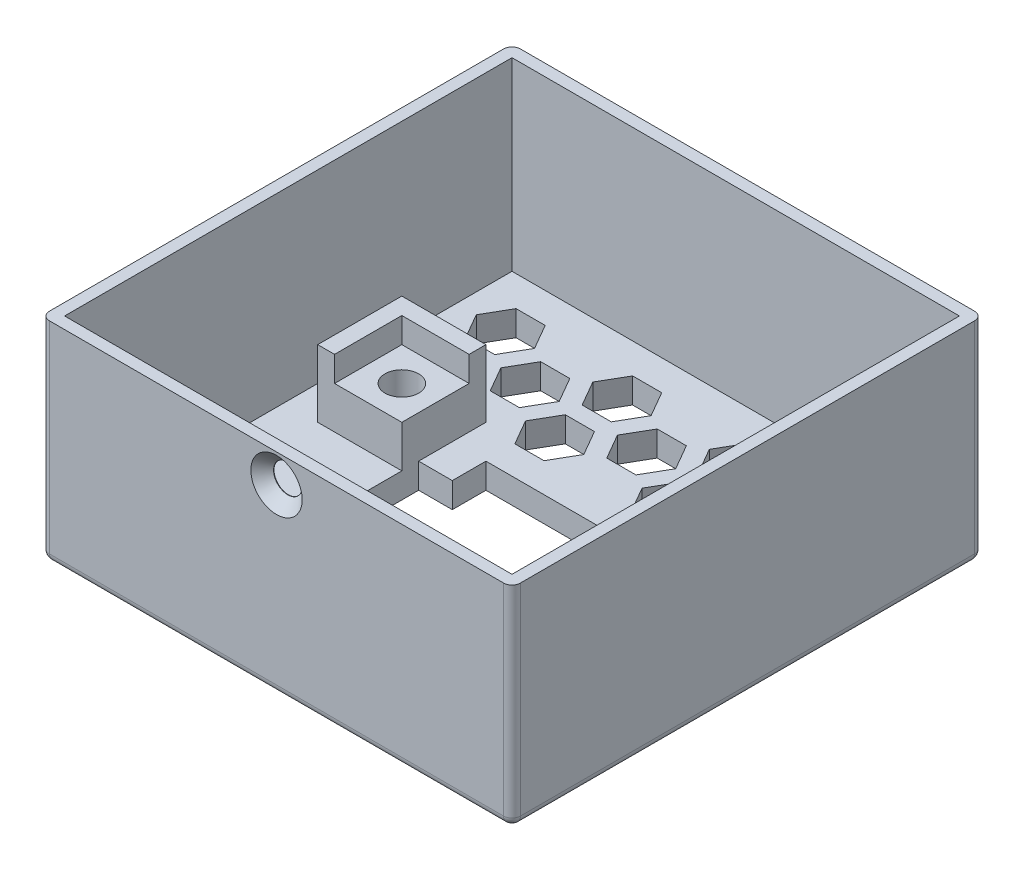
from build123d import *

# Parameters (mm, degrees)
SKETCH1_W           = 56
SKETCH1_H           = 56
BOSS_EXTRUDE1_DEPTH = 25
SKETCH2_W           = 53.2
SKETCH2_H           = 53.2
CUT_EXTRUDE1_DEPTH  = 22
SKETCH3_R           = 1.7
CUT_EXTRUDE2_DEPTH  = 1.4
SKETCH4_W           = 25.2
SKETCH4_H           = 27.2
CUT_EXTRUDE3_DEPTH  = 3
SKETCH5_W           = 4
SKETCH5_H           = 4
BOSS_EXTRUDE2_DEPTH = 3
SKETCH6_W           = 8
SKETCH6_H           = 8
BOSS_EXTRUDE3_DEPTH = 5
SKETCH7_R           = 2
CUT_EXTRUDE4_DEPTH  = 8
BOSS_EXTRUDE4_DEPTH = 3
FILLET1_R           = 1
CHAMFER1_SIZE       = 1.35
FILL_PATTERN1_DEPTH = 3


# Read off the part's stored shape, not the designer's step: Fill Pattern1
with BuildPart() as part:
    # Sketch1 → Boss-Extrude1 (new body)
    with BuildSketch(Plane(origin=(0, 0, 0), x_dir=(1, 0, 0), z_dir=(0, 1, 0))):
        Rectangle(SKETCH1_W, SKETCH1_H)
    extrude(amount=BOSS_EXTRUDE1_DEPTH)

    # Sketch2 → Cut-Extrude1 (cut)
    with BuildSketch(Plane(origin=(0, 25, 0), x_dir=(1, 0, 0), z_dir=(0, 1, 0))):
        Rectangle(SKETCH2_W, SKETCH2_H)
    extrude(amount=-CUT_EXTRUDE1_DEPTH, mode=Mode.SUBTRACT)

    # Sketch3 → Cut-Extrude2 (cut)
    with BuildSketch(Plane.XY.offset(28)):
        with Locations((0, 21.6)):
            Circle(SKETCH3_R)
    extrude(amount=-CUT_EXTRUDE2_DEPTH, mode=Mode.SUBTRACT)

    # Sketch4 → Cut-Extrude3 (cut)
    with BuildSketch(Plane.XZ):
        with Locations((0, 8.1)):
            Rectangle(SKETCH4_W, SKETCH4_H)
    extrude(amount=-CUT_EXTRUDE3_DEPTH, mode=Mode.SUBTRACT)

    # Sketch5 → Boss-Extrude2 (add)
    with BuildSketch(Plane.XZ):
        with Locations((-10.6, 19.7)):
            Rectangle(SKETCH5_W, SKETCH5_H)
        with Locations((10.6, 19.7)):
            Rectangle(SKETCH5_W, SKETCH5_H)
        with Locations((10.6, -3.5)):
            Rectangle(SKETCH5_W, SKETCH5_H)
        with Locations((-10.6, -3.5)):
            Rectangle(SKETCH5_W, SKETCH5_H)
    extrude(amount=-BOSS_EXTRUDE2_DEPTH)

    # Sketch6 → Boss-Extrude3 (add)
    with BuildSketch(Plane(origin=(0, 3, 0), x_dir=(1, 0, 0), z_dir=(0, 1, 0))):
        with Locations((16.6, -19.7)):
            Rectangle(SKETCH6_W, SKETCH6_H)
        with Locations((-16.6, -19.7)):
            Rectangle(SKETCH6_W, SKETCH6_H)
        Polygon((12.6, -0.5), (20.6, -0.5), (22.6, -0.5), (22.6, 9.5), (12.6, 9.5), (12.6, 7.5), align=None)
        Polygon((-12.6, -0.5), (-20.6, -0.5), (-22.6, -0.5), (-22.6, 9.5), (-12.6, 9.5), (-12.6, 7.5), align=None)
    extrude(amount=BOSS_EXTRUDE3_DEPTH)

    # Sketch7 → Cut-Extrude4 (cut)
    with BuildSketch(Plane(origin=(0, 8, 0), x_dir=(1, 0, 0), z_dir=(0, 1, 0))):
        with Locations(Location((16.6, -19.7, 0), (0, 0, 270))):
            Circle(SKETCH7_R)
        with Locations(Location((-16.6, -19.7, 0), (0, 0, 270))):
            Circle(SKETCH7_R)
        with Locations(Location((16.6, 3.5, 0), (0, 0, 270))):
            Circle(SKETCH7_R)
        with Locations(Location((-16.6, 3.5, 0), (0, 0, 270))):
            Circle(SKETCH7_R)
    extrude(amount=-CUT_EXTRUDE4_DEPTH, mode=Mode.SUBTRACT)

    # Sketch9 → Boss-Extrude4 (add)
    with BuildSketch(Plane(origin=(0, 8, 0), x_dir=(1, 0, 0), z_dir=(0, 1, 0))):
        Polygon((-22.6, -0.5), (-22.6, 9.5), (-12.6, 9.5), (-12.6, 7.5), (-20.6, 7.5), (-20.6, -0.5), align=None)
        Polygon((12.6, 9.5), (22.6, 9.5), (22.6, -0.5), (20.6, -0.5), (20.6, 7.5), (12.6, 7.5), align=None)
    extrude(amount=BOSS_EXTRUDE4_DEPTH)

    # Fillet1
    fillet1_edges = [part.edges().sort_by_distance(p)[0] for p in [
        (0, 0, 28),
        (-28, 0, 0),
        (0, 0, -28),
        (28, 0, 0),
        (28, 12.5, 28),
        (-28, 12.5, 28),
        (-28, 12.5, -28),
        (28, 12.5, -28),
    ]]
    fillet(fillet1_edges, radius=FILLET1_R)

    # Chamfer1
    chamfer1_edges = [part.edges().sort_by_distance(p)[0] for p in [
        (-1.7, 21.6, 28),
    ]]
    chamfer(chamfer1_edges, length=CHAMFER1_SIZE)

    # Fill Pattern1 outline → Fill Pattern1 (cut)
    with BuildSketch(Plane(origin=(0, 0, 0), x_dir=(1, 0, 0), z_dir=(0, 1, 0))):
        Polygon((22.516660498, 17), (24.248711306, 20), (22.516660498, 23), (19.052558883, 23), (17.320508076, 20), (19.052558883, 17), align=None)
        Polygon((8.660254038, 23), (5.196152423, 23), (3.464101615, 20), (5.196152423, 17), (8.660254038, 17), (10.392304845, 20), align=None)
        Polygon((-5.196152423, 23), (-8.660254038, 23), (-10.392304845, 20), (-8.660254038, 17), (-5.196152423, 17), (-3.464101615, 20), align=None)
        Polygon((-19.052558883, 23), (-22.516660498, 23), (-24.248711306, 20), (-22.516660498, 17), (-19.052558883, 17), (-17.320508076, 20), align=None)
        Polygon((1.732050808, 13), (3.464101615, 16), (1.732050808, 19), (-1.732050808, 19), (-3.464101615, 16), (-1.732050808, 13), align=None)
        Polygon((-12.124355653, 19), (-15.588457268, 19), (-17.320508076, 16), (-15.588457268, 13), (-12.124355653, 13), (-10.392304845, 16), align=None)
        Polygon((15.588457268, 19), (12.124355653, 19), (10.392304845, 16), (12.124355653, 13), (15.588457268, 13), (17.320508076, 16), align=None)
        Polygon((8.660254038, 9), (10.392304845, 12), (8.660254038, 15), (5.196152423, 15), (3.464101615, 12), (5.196152423, 9), align=None)
        Polygon((-5.196152423, 15), (-8.660254038, 15), (-10.392304845, 12), (-8.660254038, 9), (-5.196152423, 9), (-3.464101615, 12), align=None)
    extrude(amount=FILL_PATTERN1_DEPTH, mode=Mode.SUBTRACT)


solid = part.part
